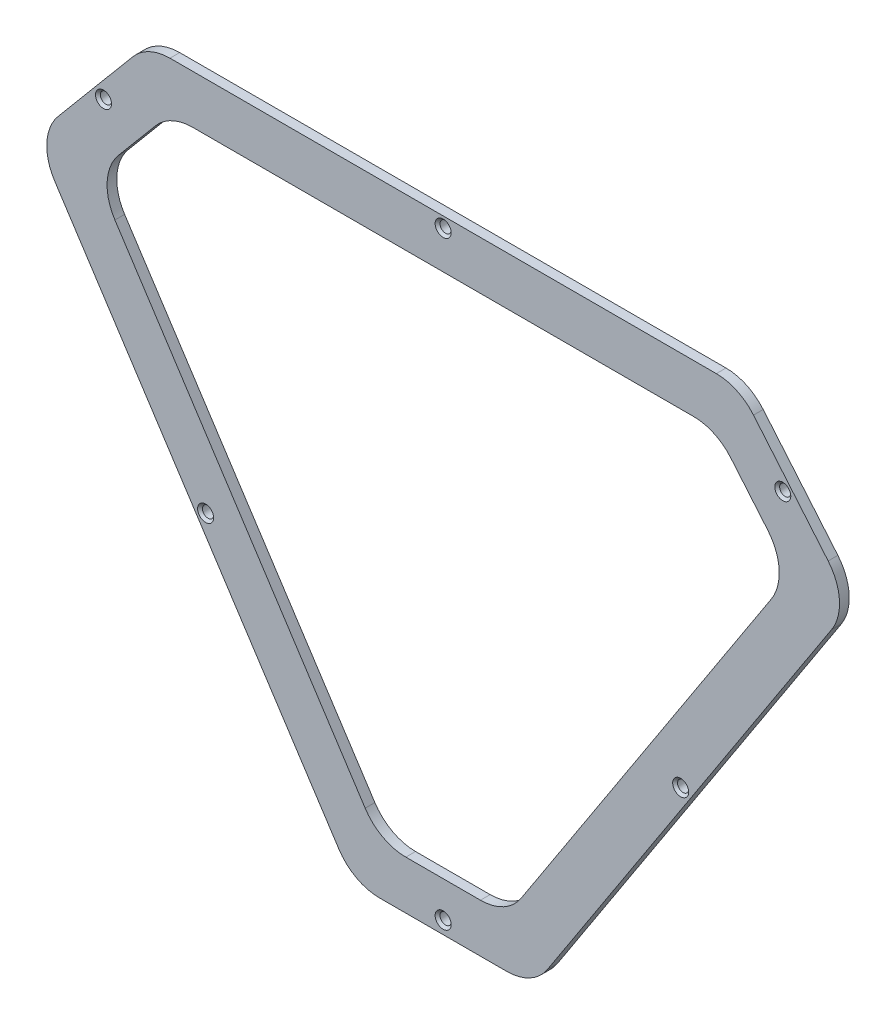
from build123d import *

# Parameters (mm, degrees)
BOSS_EXTRU_1_DEPTH      = 2
CONG_1_R                = 10
ENL_V_MAT_EXTRU_1_DEPTH = 2
CONG_2_R                = 10
ESQUISSE3_R             = 1.15
ENL_V_MAT_EXTRU_2_DEPTH = 10
CHANFREIN1_SIZE         = 0.5


with BuildPart() as part:
    # Esquisse1 → Boss.-Extru.1 (new body)
    with BuildSketch(Plane.XY):
        Polygon((-40.879571388, 34.615718895), (81.042798068, 34.615718895), (104.193503713, 7.025782272), (38.617977526, -93.674532757), (1.545249154, -93.674532757), (-64.030277033, 7.025782272), align=None)
    extrude(amount=BOSS_EXTRU_1_DEPTH)

    # Congé1
    cong_1_edges = [part.edges().sort_by_distance(p)[0] for p in [
        (-40.879571388, 34.615718895, 1),
        (-64.030277033, 7.025782272, 1),
        (1.545249154, -93.674532757, 1),
        (38.617977526, -93.674532757, 1),
        (104.193503713, 7.025782272, 1),
        (81.042798068, 34.615718895, 1),
    ]]
    fillet(cong_1_edges, radius=CONG_1_R)

    # Esquisse2 → Enlèv. mat.-Extru.1 (cut)
    with BuildSketch(Plane.XY.offset(2)):
        Polygon((-36.216494806, 24.615718895), (-51.607204261, 6.27378561), (6.96667711, -83.674532757), (33.19654957, -83.674532757), (91.770430941, 6.27378561), (76.379721487, 24.615718895), align=None)
    extrude(amount=-ENL_V_MAT_EXTRU_1_DEPTH, mode=Mode.SUBTRACT)

    # Congé2
    cong_2_edges = [part.edges().sort_by_distance(p)[0] for p in [
        (76.379721487, 24.615718895, 1),
        (91.770430941, 6.27378561, 1),
        (33.19654957, -83.674532757, 1),
        (6.96667711, -83.674532757, 1),
        (-36.216494806, 24.615718895, 1),
        (-51.607204261, 6.27378561, 1),
    ]]
    fillet(cong_2_edges, radius=CONG_2_R)

    # Esquisse3 → Enlèv. mat.-Extru.2 (cut)
    with BuildSketch(Plane.XY.offset(2)):
        with Locations((20.08161334, -91.058073416)):
            Circle(ESQUISSE3_R)
        with Locations((-28.872824595, -42.931783887)):
            Circle(ESQUISSE3_R)
        with Locations((20.08161334, 32.415718895)):
            Circle(ESQUISSE3_R)
        with Locations((90.076701777, 20.426939275)):
            Circle(ESQUISSE3_R)
        with Locations((69.036051275, -42.931783887)):
            Circle(ESQUISSE3_R)
        with Locations((-49.913475097, 20.426939275)):
            Circle(ESQUISSE3_R)
    extrude(amount=-ENL_V_MAT_EXTRU_2_DEPTH, mode=Mode.SUBTRACT)

    # Chanfrein1
    chanfrein1_edges = [part.edges().sort_by_distance(p)[0] for p in [
        (88.926701777, 20.426939275, 2),
        (18.93161334, 32.415718895, 2),
        (-51.063475097, 20.426939275, 2),
        (67.886051275, -42.931783887, 2),
        (18.93161334, -91.058073416, 2),
        (-30.022824595, -42.931783887, 2),
    ]]
    chamfer(chanfrein1_edges, length=CHANFREIN1_SIZE)


solid = part.part
